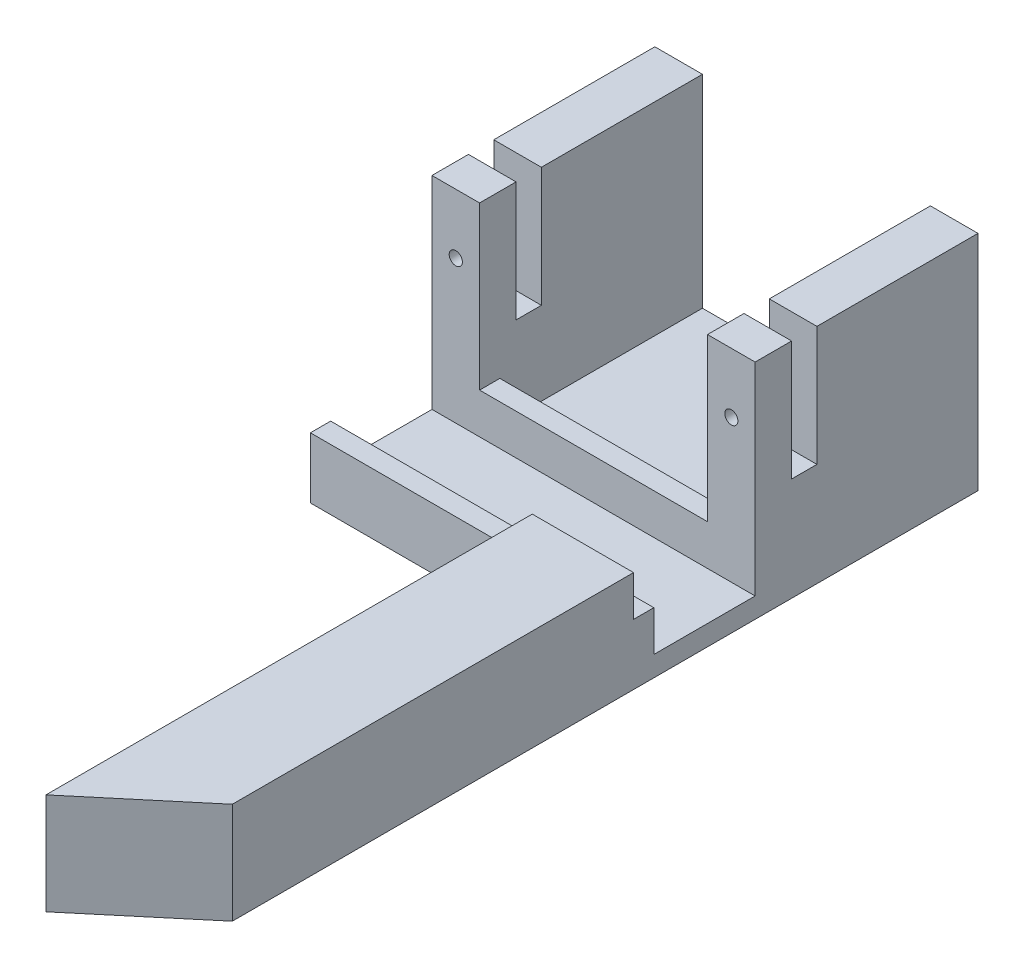
from build123d import *

# Parameters (mm, degrees)
SKETCH1_W           = 31.9
SKETCH1_H           = 34
BOSS_EXTRUDE3_DEPTH = 2
SKETCH2_W           = 4.7
SKETCH2_H           = 22
BOSS_EXTRUDE4_DEPTH = 20
SKETCH3_W           = 22.5
SKETCH3_H           = 2
SKETCH3_W_2         = 31.9
BOSS_EXTRUDE5_DEPTH = 4
SKETCH6_W           = 31.9
SKETCH6_H           = 2.5
CUT_EXTRUDE1_DEPTH  = 11.8
SKETCH7_R           = 0.65
CUT_EXTRUDE2_DEPTH  = 4
BOSS_EXTRUDE6_DEPTH = 10


with BuildPart() as part:
    # Sketch1 → Boss-Extrude3 (new body)
    with BuildSketch(Plane(origin=(0, 0, 0), x_dir=(1, 0, 0), z_dir=(0, 1, 0))):
        Rectangle(SKETCH1_W, SKETCH1_H)
    extrude(amount=BOSS_EXTRUDE3_DEPTH)

    # Sketch2 → Boss-Extrude4 (add)
    with BuildSketch(Plane(origin=(0, 2, 0), x_dir=(1, 0, 0), z_dir=(0, 1, 0))):
        with Locations((-13.6, 6)):
            Rectangle(SKETCH2_W, SKETCH2_H)
        with Locations((13.6, 6)):
            Rectangle(SKETCH2_W, SKETCH2_H)
    extrude(amount=BOSS_EXTRUDE4_DEPTH)

    # Sketch3 → Boss-Extrude5 (add)
    with BuildSketch(Plane(origin=(0, 2, 0), x_dir=(1, 0, 0), z_dir=(0, 1, 0))):
        with Locations((0, -4)):
            Rectangle(SKETCH3_W, SKETCH3_H)
        with Locations((0, -16)):
            Rectangle(SKETCH3_W_2, SKETCH3_H)
    extrude(amount=BOSS_EXTRUDE5_DEPTH)

    # Sketch6 → Cut-Extrude1 (cut)
    with BuildSketch(Plane(origin=(0, 22, 0), x_dir=(1, 0, 0), z_dir=(0, 1, 0))):
        with Locations((0, -0.15)):
            Rectangle(SKETCH6_W, SKETCH6_H)
    extrude(amount=-CUT_EXTRUDE1_DEPTH, mode=Mode.SUBTRACT)

    # Sketch7 → Cut-Extrude2 (cut)
    with BuildSketch(Plane.XY.offset(5)):
        with Locations((-13.6, 16.1)):
            Circle(SKETCH7_R)
        with Locations((13.6, 16.1)):
            Circle(SKETCH7_R)
    extrude(amount=-CUT_EXTRUDE2_DEPTH, mode=Mode.SUBTRACT)

    # Sketch8 → Boss-Extrude6 (add)
    with BuildSketch(Plane(origin=(0, 0, 0), x_dir=(1, 0, 0), z_dir=(0, 1, 0))):
        Polygon((5.95, -65), (15.95, -56.609003688), (15.95, -17), (5.95, -17), align=None)
    extrude(amount=BOSS_EXTRUDE6_DEPTH)


solid = part.part
